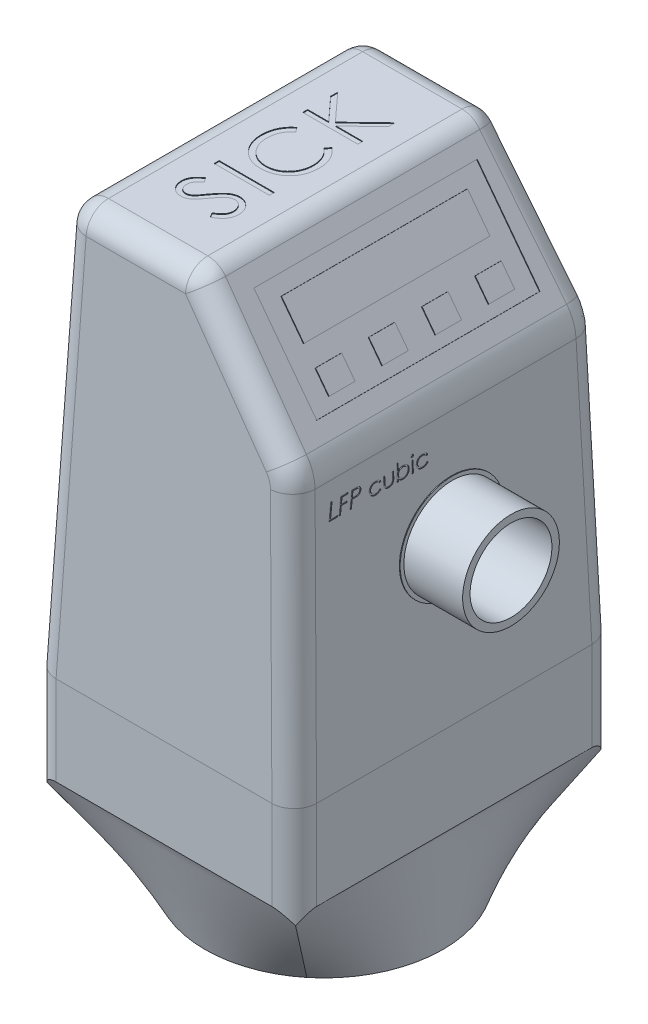
from build123d import *

# Parameters (mm, degrees)
BOSS_EXTRUDE1_DEPTH = 43
FILLET2_R           = 6
CUT_EXTRUDE5_DEPTH  = 79.096094653
FILLET3_R           = 3
SKETCH10_W          = 35
SKETCH10_H          = 43
BOSS_EXTRUDE2_DEPTH = 12
FILLET4_R           = 3
SKETCH17_W          = 30
SKETCH17_H          = 14
CUT_EXTRUDE6_DEPTH  = 0.1
SKETCH18_W          = 25
SKETCH18_H          = 5
SKETCH18_W_2        = 3.5
SKETCH18_H_2        = 3
BOSS_EXTRUDE3_DEPTH = 0.1
SKETCH23_W          = 7.408333334
SKETCH23_H          = 0.664850427
CUT_EXTRUDE8_DEPTH  = 0.1
SKETCH24_W          = 0.189957265
SKETCH24_H          = 1.546794872
CUT_EXTRUDE9_DEPTH  = 0.1
SKETCH25_R          = 6.5
SKETCH25_R_2        = 5.5
BOSS_EXTRUDE4_DEPTH = 8
SKETCH26_R          = 7
BOSS_EXTRUDE5_DEPTH = 0.1


with BuildPart() as part:
    # Sketch1 → Boss-Extrude1 (new body)
    with BuildSketch(Plane.XY):
        Polygon((0, 0), (35, 0), (33.770964999, 37.397128059), (20.457888171, 55), (2.764030826, 55), align=None)
    extrude(amount=BOSS_EXTRUDE1_DEPTH)

    # Fillet2
    fillet2_edges = [part.edges().sort_by_distance(p)[0] for p in [
        (33.770964999, 37.397128059, 21.5),
    ]]
    fillet(fillet2_edges, radius=FILLET2_R)

    # Sketch9 → Cut-Extrude5 (cut, through all)
    with BuildSketch(Plane(origin=(0, 0, 0), x_dir=(0, 0, -1), z_dir=(1, 0, 0))):
        Polygon((0, 55), (-1.5, 55), (0, 0), align=None)
        Polygon((-43, 55), (-41.5, 55), (-43, 0), align=None)
    extrude(amount=CUT_EXTRUDE5_DEPTH, mode=Mode.SUBTRACT)

    # Fillet3
    fillet3_edges = [part.edges().sort_by_distance(p)[0] for p in [
        (33.492928787, 37.298649734, 41.982764098),
        (33.492928787, 37.298649734, 1.017235902),
        (20.457888171, 55, 21.5),
        (2.764030826, 55, 21.5),
        (11.610959499, 55, 1.5),
        (1.382015413, 27.5, 0.75),
        (34.416758242, 17.746904445, 0.484006485),
        (26.54006445, 46.957999526, 1.280672714),
        (11.610959499, 55, 41.5),
        (1.382015413, 27.5, 42.25),
        (34.416758242, 17.746904445, 42.515993515),
        (26.54006445, 46.957999526, 41.719327286),
    ]]
    fillet(fillet3_edges, radius=FILLET3_R)

    # Sketch10 → Boss-Extrude2 (add)
    with BuildSketch(Plane.XZ):
        with Locations((17.5, 21.5)):
            Rectangle(SKETCH10_W, SKETCH10_H)
    extrude(amount=BOSS_EXTRUDE2_DEPTH)

    # Sketch12 for Loft3 → Loft3 section 0
    with BuildSketch(Plane(origin=(0, -27, 0), x_dir=(-1, 0, 0), z_dir=(0, -1, 0))):
        with BuildLine():
            # circular arc as an exact rational Bezier (weights 1, cos(half-angle), 1)
            Bezier((-27.600342374, -9.091007941), (-42.845675475, -21.5), (-27.600342374, -33.908992059), weights=[1, 0.631271398, 1])
            Bezier((-27.600342374, -33.908992059), (-17.5, -42.130200969), (-7.399657626, -33.908992059), weights=[1, 0.775562004, 1])
            Bezier((-7.399657626, -33.908992059), (7.845675475, -21.5), (-7.399657626, -9.091007941), weights=[1, 0.631271398, 1])
            Bezier((-7.399657626, -9.091007941), (-17.5, -0.869799031), (-27.600342374, -9.091007941), weights=[1, 0.775562004, 1])
        make_face()
    # Sketch11 → Loft3 section 1
    with BuildSketch(Plane(origin=(0, -12, 0), x_dir=(-1, 0, 0), z_dir=(0, -1, 0))):
        with BuildLine():
            Line((-35, 0), (-35, -43))
            Line((-35, -43), (0, -43))
            Line((0, -43), (0, 0))
            Line((0, 0), (-35, 0))
        make_face()
    loft()

    # Fillet4
    # the kernel refuses this fillet: 3 mm, written as the material it takes off along each edge
    with BuildSketch(Plane(origin=(0, 7.5, 0), x_dir=(1, 0, 0), z_dir=(0, -1, 0)), Plane(origin=(0, 7.5, 43), x_dir=(0, 0, -1), z_dir=(0, -1, 0))) as fillet4_piece_1:
        with BuildLine():
            CenterArc((FILLET4_R, FILLET4_R), FILLET4_R, 180, 90)
            Line((0, FILLET4_R), (0, 0))
            Line((0, 0), (FILLET4_R, 0))
        make_face()
    extrude(amount=27, mode=Mode.SUBTRACT)
    with BuildSketch(Plane(origin=(35, 7.5, 43), x_dir=(0, 0, -1), z_dir=(0, -1, 0)), Plane(origin=(35, 7.5, 0), x_dir=(-1, 0, 0), z_dir=(0, -1, 0))) as fillet4_piece_2:
        with BuildLine():
            CenterArc((FILLET4_R, -FILLET4_R), FILLET4_R, 90, 90)
            Line((0, -FILLET4_R), (0, 0))
            Line((0, 0), (FILLET4_R, 0))
        make_face()
    extrude(amount=27, mode=Mode.SUBTRACT)

    # Sketch17 → Cut-Extrude6 (cut)
    with BuildSketch(Plane(origin=(39.475056316, 29.855040658, 0), x_dir=(0, 0, -1), z_dir=(0.7975811093710329, 0.6032117157138714, 0))):
        with Locations((-21.185003541, 20.700547897)):
            Rectangle(SKETCH17_W, SKETCH17_H)
    extrude(amount=-CUT_EXTRUDE6_DEPTH, mode=Mode.SUBTRACT)

    # Sketch18 → Boss-Extrude3 (add)
    with BuildSketch(Plane(origin=(39.395298205, 29.794719487, 0), x_dir=(0, 0, -1), z_dir=(0.7975811093710329, 0.6032117157138717, 0))):
        with Locations((-21.185003541, 23.200547897)):
            Rectangle(SKETCH18_W, SKETCH18_H)
        with Locations((-31.935003541, 16.600547897)):
            Rectangle(SKETCH18_W_2, SKETCH18_H_2)
        with Locations((-24.785003541, 16.600547897)):
            Rectangle(SKETCH18_W_2, SKETCH18_H_2)
        with Locations((-17.635003541, 16.600547897)):
            Rectangle(SKETCH18_W_2, SKETCH18_H_2)
        with Locations((-10.485003541, 16.600547897)):
            Rectangle(SKETCH18_W_2, SKETCH18_H_2)
    extrude(amount=BOSS_EXTRUDE3_DEPTH)

    # Sketch23 → Cut-Extrude8 (cut)
    with BuildSketch(Plane(origin=(0, 55, 0), x_dir=(1, 0, 0), z_dir=(0, 1, 0))):
        with BuildLine():
            Line((14.634451947, -33.919087495), (14.25898954, -33.292822138))
            add(Edge.make_bspline(
                [(14.25898954, -33.292822138), (14.356492489, -33.234575202), (14.543304375, -33.122976321), (14.795733893, -32.936812611), (15.010283792, -32.743914616), (15.185705945, -32.54285386), (15.323816088, -32.334857603), (15.421610812, -32.118568023), (15.482604627, -31.89471399), (15.490013143, -31.742369401), (15.493711763, -31.666313056)],
                knots=[0, 0, 0, 0, 1.272034388, 2.437168799, 3.508375237, 4.49857839, 5.41946034, 6.295179144, 7.148887113, 8, 8, 8, 8], degree=3))
            add(Edge.make_bspline(
                [(15.493711763, -31.666313056), (15.491859668, -31.601372351), (15.488187885, -31.472627251), (15.454332222, -31.282722248), (15.398944428, -31.099209343), (15.323860277, -30.923912769), (15.23156553, -30.761476738), (15.122732704, -30.616751975), (14.996980268, -30.494547256), (14.858966757, -30.393238067), (14.710969987, -30.314845752), (14.558480338, -30.255596078), (14.399405537, -30.22241307), (14.292275767, -30.217433671), (14.238212965, -30.214920829)],
                knots=[0, 0, 0, 0, 1.09553864, 2.171907928, 3.244545276, 4.325730702, 5.384330216, 6.391480148, 7.371786628, 8.333890167, 9.27165687, 10.191402356, 11.087295184, 12, 12, 12, 12], degree=3))
            add(Edge.make_bspline(
                [(14.238212965, -30.214920829), (14.176510912, -30.217974429), (14.051557527, -30.224158302), (13.866888061, -30.278657186), (13.683347107, -30.361874701), (13.569793819, -30.440089812), (13.51103281, -30.480564192)],
                knots=[0, 0, 0, 0, 0.938992559, 1.901562324, 2.914110574, 4, 4, 4, 4], degree=3))
            add(Edge.make_bspline(
                [(13.51103281, -30.480564192), (13.468595002, -30.513728796), (13.379502132, -30.583353734), (13.246997249, -30.703152516), (13.110041623, -30.84301255), (12.965628598, -31.001019628), (12.814957649, -31.177438795), (12.656853016, -31.372338309), (12.494545583, -31.587381525), (12.385831002, -31.738319633), (12.329736068, -31.816201211)],
                knots=[0, 0, 0, 0, 0.72225051, 1.516274602, 2.393638633, 3.3469932, 4.386926276, 5.505032946, 6.712638081, 8, 8, 8, 8], degree=3))
            add(Edge.make_bspline(
                [(12.329736068, -31.816201211), (12.274218891, -31.894145336), (12.168074276, -32.043168568), (12.010542875, -32.251572567), (11.866516684, -32.437933347), (11.734639859, -32.601422599), (11.614894512, -32.741968412), (11.508430541, -32.860678299), (11.41236867, -32.954528245), (11.350051164, -33.006715891), (11.322072139, -33.030146857)],
                knots=[0, 0, 0, 0, 1.452282411, 2.77665338, 3.964542531, 5.026858415, 5.96415736, 6.766646006, 7.446254459, 8, 8, 8, 8], degree=3))
            add(Edge.make_bspline(
                [(11.322072139, -33.030146857), (11.278464447, -33.062891589), (11.192704067, -33.127288498), (11.058697297, -33.212384764), (10.921780532, -33.284146678), (10.781457555, -33.341901601), (10.638782976, -33.38860582), (10.492685652, -33.421077233), (10.344157378, -33.441091925), (10.244225594, -33.443159386), (10.194200879, -33.444194333)],
                knots=[0, 0, 0, 0, 1.068019517, 2.100403715, 3.106014851, 4.09224787, 5.069873182, 6.043214339, 7.020455327, 8, 8, 8, 8], degree=3))
            add(Edge.make_bspline(
                [(10.194200879, -33.444194333), (10.115821036, -33.441431764), (9.960736664, -33.435965673), (9.734190297, -33.389734794), (9.517887428, -33.316773819), (9.314019344, -33.214524662), (9.127708282, -33.082840017), (8.957277266, -32.929785489), (8.812045246, -32.749176977), (8.687130449, -32.549229928), (8.588347253, -32.331522086), (8.516758726, -32.102323068), (8.474236041, -31.863280432), (8.468303277, -31.701109953), (8.465292959, -31.61882374)],
                knots=[0, 0, 0, 0, 1.005248779, 1.989011071, 2.95484373, 3.928844559, 4.904706341, 5.875556129, 6.859318422, 7.868909462, 8.894684146, 9.918924798, 10.944050749, 12, 12, 12, 12], degree=3))
            add(Edge.make_bspline(
                [(8.465292959, -31.61882374), (8.468263141, -31.531509592), (8.474169885, -31.35786962), (8.526805631, -31.10286268), (8.610577802, -30.856339566), (8.708864506, -30.658906974), (8.806404599, -30.50405926), (8.895441356, -30.386086639), (8.997732004, -30.265889215), (9.11543299, -30.14475875), (9.246190174, -30.021499436), (9.391110427, -29.896679034), (9.548887781, -29.769129438), (9.661551125, -29.687100811), (9.719307716, -29.645049034)],
                knots=[0, 0, 0, 0, 1.286507425, 2.558452658, 3.822738219, 5.118007103, 5.800084425, 6.519418873, 7.295692132, 8.12638276, 9.008892966, 9.945018126, 10.946518512, 12, 12, 12, 12], degree=3))
            Line((9.719307716, -29.645049034), (10.174908344, -30.246085693))
            add(Edge.make_bspline(
                [(10.174908344, -30.246085693), (10.128151243, -30.28237527), (10.038108, -30.352260512), (9.912051375, -30.458403123), (9.796747858, -30.558293492), (9.696861173, -30.657462783), (9.604911411, -30.748267052), (9.52758464, -30.837963291), (9.462437702, -30.923090111), (9.392786955, -31.030134734), (9.325832937, -31.16573575), (9.267021704, -31.334537194), (9.232131741, -31.511537787), (9.227477957, -31.63202845), (9.225122019, -31.693025797)],
                knots=[0, 0, 0, 0, 1.181392137, 2.275085037, 3.289537922, 4.225335853, 5.084247276, 5.86831218, 6.587234301, 7.222706459, 8.415108401, 9.595592188, 10.782789524, 12, 12, 12, 12], degree=3))
            add(Edge.make_bspline(
                [(9.225122019, -31.693025797), (9.227644787, -31.769575163), (9.232509708, -31.917193404), (9.287040066, -32.126279835), (9.369949801, -32.315555232), (9.489504774, -32.477794039), (9.63203733, -32.611752106), (9.794585672, -32.70985473), (9.97411399, -32.768508564), (10.099287274, -32.775687692), (10.163036015, -32.779343906)],
                knots=[0, 0, 0, 0, 1.144248881, 2.206576175, 3.214949548, 4.222996039, 5.203671638, 6.127710127, 7.046472867, 8, 8, 8, 8], degree=3))
            add(Edge.make_bspline(
                [(10.163036015, -32.779343906), (10.202717543, -32.778464251), (10.282633378, -32.776692688), (10.400140359, -32.754054976), (10.517027763, -32.723446929), (10.632884208, -32.676523325), (10.750333185, -32.611178321), (10.871033566, -32.525459672), (10.996024995, -32.417476129), (11.077320806, -32.334763925), (11.120242545, -32.291094373)],
                knots=[0, 0, 0, 0, 0.858259122, 1.72847414, 2.583651051, 3.473048463, 4.427392529, 5.488649985, 6.674082839, 8, 8, 8, 8], degree=3))
            add(Edge.make_bspline(
                [(11.120242545, -32.291094373), (11.13471425, -32.274877802), (11.169095708, -32.236350939), (11.225382702, -32.165916897), (11.294815236, -32.07290464), (11.380725056, -31.959742981), (11.480380818, -31.824345399), (11.592508297, -31.666697005), (11.720747518, -31.488555094), (11.810404313, -31.362143705), (11.857810988, -31.295302773)],
                knots=[0, 0, 0, 0, 0.420754252, 0.999615792, 1.744751191, 2.668019286, 3.750313428, 4.999500688, 6.413464383, 8, 8, 8, 8], degree=3))
            add(Edge.make_bspline(
                [(11.857810988, -31.295302773), (11.916318574, -31.214899314), (12.029610405, -31.059209158), (12.199823035, -30.837683179), (12.36629606, -30.636827246), (12.527955564, -30.455921307), (12.683611445, -30.29322791), (12.835015703, -30.150387101), (12.981175452, -30.026750777), (13.167287082, -29.891829677), (13.39797926, -29.755599361), (13.680748094, -29.638793063), (13.964328385, -29.564482895), (14.154682129, -29.554832055), (14.248601253, -29.550070401)],
                knots=[0, 0, 0, 0, 1.163604038, 2.253157948, 3.268574773, 4.215621239, 5.091738613, 5.902582348, 6.650434646, 7.330118262, 8.591011492, 9.77460283, 10.902005569, 12, 12, 12, 12], degree=3))
            add(Edge.make_bspline(
                [(14.248601253, -29.550070401), (14.315018088, -29.551462762), (14.44656199, -29.554220443), (14.639728801, -29.585867095), (14.827292758, -29.63234039), (15.00674992, -29.70182183), (15.180979725, -29.788009384), (15.346700023, -29.895805198), (15.507130401, -30.021407724), (15.657773164, -30.165414871), (15.796233272, -30.322911108), (15.918890944, -30.489972942), (16.023518921, -30.664856398), (16.106844846, -30.849455347), (16.172454071, -31.041786705), (16.219858129, -31.242484712), (16.248984291, -31.451752669), (16.252005023, -31.593994492), (16.253540823, -31.666313056)],
                knots=[0, 0, 0, 0, 0.983922938, 1.948738757, 2.895227473, 3.844781104, 4.796118043, 5.772795661, 6.770647148, 7.813532943, 8.8582745, 9.876489951, 10.882905461, 11.874265028, 12.874055871, 13.891769171, 14.928133632, 16, 16, 16, 16], degree=3))
            add(Edge.make_bspline(
                [(16.253540823, -31.666313056), (16.252458821, -31.722267866), (16.250308446, -31.833472791), (16.231298071, -31.997957863), (16.204401361, -32.159119985), (16.161699605, -32.314936912), (16.109889908, -32.467415988), (16.046097466, -32.615894725), (15.96964802, -32.760442517), (15.882245477, -32.901879232), (15.780502786, -33.039807246), (15.662107138, -33.173082423), (15.530077586, -33.305210863), (15.382374501, -33.435255291), (15.217373659, -33.560378546), (15.037532815, -33.683584439), (14.842317162, -33.804272529), (14.705034514, -33.880101006), (14.634451947, -33.919087495)],
                knots=[0, 0, 0, 0, 0.915313873, 1.819100311, 2.706792138, 3.586475221, 4.459428225, 5.3405999, 6.2277379, 7.133009489, 8.059106158, 9.028520402, 10.047404263, 11.114294124, 12.246039232, 13.433834781, 14.680630578, 16, 16, 16, 16], degree=3))
        make_face()
        with Locations((12.359416891, -27.071128094)):
            Rectangle(SKETCH23_W, SKETCH23_H)
        with BuildLine():
            Line((10.014631902, -17.658745615), (10.459844241, -18.240489739))
            add(Edge.make_bspline(
                [(10.459844241, -18.240489739), (10.410386926, -18.281989295), (10.312139088, -18.364428903), (10.174166105, -18.497051296), (10.044947262, -18.635296495), (9.923652311, -18.77897215), (9.815156346, -18.931403248), (9.711009611, -19.086781735), (9.61982556, -19.2507532), (9.508432836, -19.476343011), (9.394729012, -19.772603653), (9.296933908, -20.144258235), (9.235266565, -20.532763551), (9.228542268, -20.797755007), (9.225122019, -20.932540353)],
                knots=[0, 0, 0, 0, 0.75789156, 1.505565099, 2.245254514, 2.979266606, 3.711207489, 4.440978832, 5.174393176, 5.91211879, 7.394186119, 8.890401545, 10.418332761, 12, 12, 12, 12], degree=3))
            add(Edge.make_bspline(
                [(9.225122019, -20.932540353), (9.225977073, -21.006800004), (9.227679245, -21.154630105), (9.250135227, -21.374019373), (9.281697288, -21.589311999), (9.328529223, -21.800367935), (9.387737931, -22.006918533), (9.458488398, -22.210314108), (9.546022783, -22.407609912), (9.64277203, -22.601535053), (9.752049765, -22.787334863), (9.87124765, -22.963132976), (9.999024201, -23.128298508), (10.135886314, -23.282924446), (10.281114736, -23.427307553), (10.436336506, -23.559630979), (10.599892254, -23.681662666), (10.771917804, -23.79270713), (10.950811005, -23.892672936), (11.137593228, -23.976728634), (11.329066386, -24.050142312), (11.526587886, -24.10914786), (11.728844899, -24.155488963), (11.936675318, -24.187527069), (12.149685108, -24.209722802), (12.294061237, -24.211417173), (12.366837097, -24.212271256)],
                knots=[0, 0, 0, 0, 1.054877232, 2.099964208, 3.13098259, 4.145888998, 5.169474743, 6.183358035, 7.203388855, 8.234598956, 9.261847606, 10.264062591, 11.251197969, 12.227332808, 13.196685059, 14.158975844, 15.123498106, 16.094582253, 17.066912473, 18.032714859, 19.002806091, 19.979168736, 20.95977404, 21.949109834, 22.966205168, 24, 24, 24, 24], degree=3))
            add(Edge.make_bspline(
                [(12.366837097, -24.212271256), (12.476332616, -24.209594143), (12.691312545, -24.204337987), (13.006244988, -24.157757916), (13.308240104, -24.086406372), (13.595253113, -23.981220652), (13.869676615, -23.84893292), (14.128182664, -23.683874306), (14.374558449, -23.491983985), (14.602836891, -23.271293408), (14.811354662, -23.029128027), (14.994977507, -22.769313312), (15.148043802, -22.49248612), (15.275416278, -22.201705707), (15.373326336, -21.894733733), (15.442253735, -21.57212241), (15.487216349, -21.234573351), (15.491520989, -21.003921455), (15.493711763, -20.886535078)],
                knots=[0, 0, 0, 0, 1.029159485, 2.020618137, 2.987588728, 3.942669054, 4.889339625, 5.846988364, 6.821327795, 7.821533711, 8.827683044, 9.822769455, 10.807800696, 11.797391277, 12.803701919, 13.832062008, 14.896664671, 16, 16, 16, 16], degree=3))
            add(Edge.make_bspline(
                [(15.493711763, -20.886535078), (15.490137179, -20.757201053), (15.483101543, -20.502640753), (15.423497799, -20.12932843), (15.326855206, -19.771959393), (15.191604604, -19.430514418), (15.015783078, -19.105956084), (14.802639237, -18.797776486), (14.5501456, -18.505715495), (14.357352978, -18.330092948), (14.25898954, -18.240489739)],
                knots=[0, 0, 0, 0, 1.028121516, 2.023589091, 2.998037872, 3.967518031, 4.937445131, 5.927275754, 6.942489185, 8, 8, 8, 8], degree=3))
            Line((14.25898954, -18.240489739), (14.699749757, -17.658745615))
            add(Edge.make_bspline(
                [(14.699749757, -17.658745615), (14.760154056, -17.705563923), (14.880673322, -17.79897628), (15.050612779, -17.950204736), (15.210313829, -18.109632634), (15.35897893, -18.277669768), (15.49722343, -18.454612314), (15.625122425, -18.640444035), (15.741997156, -18.835006307), (15.849352333, -19.036753743), (15.943874928, -19.246151231), (16.027635755, -19.461355353), (16.096980467, -19.683685616), (16.155638312, -19.911270491), (16.197463996, -20.146165393), (16.230770693, -20.385639842), (16.250530694, -20.631935236), (16.252528445, -20.797952367), (16.253540823, -20.882082955)],
                knots=[0, 0, 0, 0, 0.986911346, 1.969095443, 2.935967484, 3.900112155, 4.865124501, 5.834589912, 6.812044781, 7.795288262, 8.784678562, 9.777857908, 10.776141921, 11.791195789, 12.811324908, 13.855933174, 14.913475973, 16, 16, 16, 16], degree=3))
            add(Edge.make_bspline(
                [(16.253540823, -20.882082955), (16.252986272, -20.96176205), (16.251889716, -21.119317594), (16.234126295, -21.351936618), (16.209891018, -21.578397898), (16.173399408, -21.798054189), (16.130337221, -22.01210417), (16.072613061, -22.218607407), (16.007950659, -22.419595936), (15.93195177, -22.614262257), (15.846192517, -22.802771955), (15.749267051, -22.984517022), (15.641990437, -23.159413871), (15.526727332, -23.329182011), (15.399775376, -23.491313563), (15.262897666, -23.647213525), (15.116555544, -23.7977561), (15.011029437, -23.890895117), (14.957972914, -23.937723647)],
                knots=[0, 0, 0, 0, 1.114604814, 2.203992996, 3.262667896, 4.300477797, 5.318619304, 6.316056647, 7.298880507, 8.271930387, 9.238335007, 10.195173496, 11.151986948, 12.108099108, 13.064862484, 14.031167946, 15.010108607, 16, 16, 16, 16], degree=3))
            add(Edge.make_bspline(
                [(14.957972914, -23.937723647), (14.865808829, -24.0127242), (14.682593346, -24.161819834), (14.385682679, -24.352657894), (14.075958829, -24.515469594), (13.751627821, -24.64857833), (13.412563572, -24.750821369), (13.059311537, -24.822704872), (12.692577887, -24.869091186), (12.4431602, -24.874415369), (12.316379698, -24.877121684)],
                knots=[0, 0, 0, 0, 0.994611881, 1.977215934, 2.950189954, 3.921972279, 4.908960509, 5.911694611, 6.938501887, 8, 8, 8, 8], degree=3))
            add(Edge.make_bspline(
                [(12.316379698, -24.877121684), (12.183123988, -24.873829857), (11.920951698, -24.867353394), (11.53619683, -24.812328961), (11.167576369, -24.723812509), (10.815778443, -24.598089094), (10.478952683, -24.438692767), (10.159672133, -24.241786435), (9.855894907, -24.00965765), (9.57223035, -23.744126966), (9.312855387, -23.452942773), (9.084665589, -23.14111795), (8.894763514, -22.809262829), (8.736021636, -22.461033376), (8.614007523, -22.093822017), (8.528593278, -21.708412219), (8.475428715, -21.305528182), (8.468707858, -21.030652715), (8.465292959, -20.890987202)],
                knots=[0, 0, 0, 0, 1.032925535, 2.032216505, 3.007276963, 3.968222605, 4.92396291, 5.891752235, 6.871517503, 7.883894988, 8.900124299, 9.891468569, 10.874487609, 11.85992873, 12.854644235, 13.869047385, 14.917252991, 16, 16, 16, 16], degree=3))
            add(Edge.make_bspline(
                [(8.465292959, -20.890987202), (8.466314373, -20.805866849), (8.468336157, -20.637379682), (8.488021294, -20.388132521), (8.520905724, -20.145487807), (8.565429083, -19.909190352), (8.62149727, -19.678557003), (8.691376192, -19.454019237), (8.774571959, -19.23612689), (8.869577669, -19.024950748), (8.976411045, -18.821916367), (9.093811958, -18.627151209), (9.221187211, -18.441431749), (9.359840838, -18.265723278), (9.508622723, -18.09981082), (9.665790094, -17.941233216), (9.835375986, -17.79460651), (9.95477055, -17.70411548), (10.014631902, -17.658745615)],
                knots=[0, 0, 0, 0, 1.096622143, 2.170653093, 3.219033441, 4.250379162, 5.267604342, 6.275621678, 7.278284436, 8.271072515, 9.257558938, 10.232633088, 11.19973724, 12.157384997, 13.114417402, 14.069920322, 15.032307892, 16, 16, 16, 16], degree=3))
        make_face()
        Polygon((8.655250224, -15.512228521), (8.655250224, -14.847378094), (11.476412417, -14.847378094), (8.655250224, -11.759088497), (8.655250224, -10.810786213), (11.979502361, -14.451139111), (16.063583558, -10.525850316), (16.063583558, -11.411822872), (12.488528469, -14.847378094), (16.063583558, -14.847378094), (16.063583558, -15.512228521), align=None)
    extrude(amount=-CUT_EXTRUDE8_DEPTH, mode=Mode.SUBTRACT)

    # Sketch24 → Cut-Extrude9 (cut)
    # profile 1 of 9: a face of its own
    with BuildSketch(Plane(origin=(34.962238327, 1.149013757, 0), x_dir=(0, 0, -1), z_dir=(0.9994604019440667, 0.03284668850591543, 0))):
        Polygon((-37.021152137, 31.897984299), (-36.829498825, 31.897984299), (-37.100018323, 29.971274897), (-36.151080022, 29.971274897), (-36.175248691, 29.781317632), (-37.317960363, 29.781317632), align=None)
    # profile 2 of 9: a face of its own
    with BuildSketch(Plane(origin=(34.962238327, 1.149013757, 0), x_dir=(0, 0, -1), z_dir=(0.9994604019440667, 0.03284668850591543, 0))):
        Polygon((-34.685695406, 31.897984299), (-34.711560123, 31.708027034), (-35.49979797, 31.708027034), (-35.59901672, 31.002471478), (-34.821379167, 31.002471478), (-34.847243884, 30.812514213), (-35.625305449, 30.812514213), (-35.769893456, 29.781317632), (-35.961122757, 29.781317632), (-35.66431453, 31.897984299), align=None)
    # profile 3 of 9: a face of its own
    with BuildSketch(Plane(origin=(34.962238327, 1.149013757, 0), x_dir=(0, 0, -1), z_dir=(0.9994604019440667, 0.03284668850591543, 0))):
        with BuildLine():
            Line((-34.198929915, 31.897984299), (-33.639658414, 31.897984299))
            add(Edge.make_bspline(
                [(-33.639658414, 31.897984299), (-33.617324045, 31.89784494), (-33.574335824, 31.897576708), (-33.512414034, 31.894893846), (-33.455276407, 31.891194958), (-33.403005677, 31.886038257), (-33.355665035, 31.878198497), (-33.31333701, 31.869421412), (-33.27558343, 31.859573902), (-33.232520984, 31.843167959), (-33.183994838, 31.818013345), (-33.131810482, 31.780249435), (-33.086454921, 31.733829748), (-33.046848511, 31.680935356), (-33.015067777, 31.621215963), (-32.992501524, 31.555691094), (-32.978658574, 31.485152498), (-32.976954776, 31.436300253), (-32.976080022, 31.411218807)],
                knots=[0, 0, 0, 0, 1.135332684, 2.185238988, 3.150208107, 4.046040219, 4.854001743, 5.588181339, 6.243560949, 6.834748932, 7.927376448, 9.012417828, 10.094600696, 11.214043572, 12.361542901, 13.518161337, 14.725788303, 16, 16, 16, 16], degree=3))
            add(Edge.make_bspline(
                [(-32.976080022, 31.411218807), (-32.976359801, 31.394525072), (-32.976909116, 31.361748758), (-32.982624939, 31.313384947), (-32.991949274, 31.266763014), (-33.004714913, 31.221682283), (-33.020789399, 31.177977253), (-33.041177159, 31.136209808), (-33.065233376, 31.096093845), (-33.092071042, 31.057634077), (-33.122197135, 31.02192635), (-33.154019828, 30.988571858), (-33.188062231, 30.958373399), (-33.224147284, 30.931253798), (-33.261999855, 30.907037621), (-33.301539826, 30.885587423), (-33.343398793, 30.867791217), (-33.372319968, 30.858113854), (-33.386947409, 30.853219342)],
                knots=[0, 0, 0, 0, 1.077613652, 2.115775993, 3.139637116, 4.14510796, 5.138576732, 6.142762576, 7.14141659, 8.156821813, 9.16766358, 10.155287502, 11.131543445, 12.102666116, 13.067290607, 14.031007908, 15.004144336, 16, 16, 16, 16], degree=3))
            add(Edge.make_bspline(
                [(-33.386947409, 30.853219342), (-33.398788911, 30.849987259), (-33.42427021, 30.843032256), (-33.465867633, 30.83460182), (-33.513640885, 30.828220177), (-33.567464006, 30.822002543), (-33.627760138, 30.818261602), (-33.694173414, 30.814550548), (-33.766716336, 30.813220319), (-33.817036982, 30.812755656), (-33.843184055, 30.812514213)],
                knots=[0, 0, 0, 0, 0.641206386, 1.379788876, 2.215232503, 3.158725674, 4.209900022, 5.370746801, 6.633815758, 8, 8, 8, 8], degree=3))
            Line((-33.843184055, 30.812514213), (-34.159920834, 30.812514213))
            Line((-34.159920834, 30.812514213), (-34.304508841, 29.781317632))
            Line((-34.304508841, 29.781317632), (-34.495738141, 29.781317632))
            Line((-34.495738141, 29.781317632), (-34.198929915, 31.897984299))
        make_face()
        with BuildLine():
            Line((-34.034413355, 31.708027034), (-34.133208093, 31.002471478))
            Line((-34.133208093, 31.002471478), (-33.836399867, 31.002471478))
            add(Edge.make_bspline(
                [(-33.836399867, 31.002471478), (-33.812372786, 31.002711448), (-33.766291604, 31.003171681), (-33.69996521, 31.004512315), (-33.6394849, 31.00819491), (-33.584706043, 31.012016704), (-33.535765961, 31.017989473), (-33.492654315, 31.02521456), (-33.454957427, 31.032869355), (-33.413108281, 31.045784291), (-33.366615481, 31.066162989), (-33.316935593, 31.098381594), (-33.272733777, 31.137737283), (-33.235177421, 31.184174828), (-33.204330397, 31.235321963), (-33.181974922, 31.290363277), (-33.168315205, 31.348222048), (-33.166801713, 31.387824505), (-33.166037287, 31.407826713)],
                knots=[0, 0, 0, 0, 1.292499712, 2.478866002, 3.567711026, 4.55136461, 5.4320969, 6.218239379, 6.902667729, 7.499057556, 8.571240445, 9.621392161, 10.671323708, 11.74113212, 12.821985709, 13.872330035, 14.925367204, 16, 16, 16, 16], degree=3))
            add(Edge.make_bspline(
                [(-33.166037287, 31.407826713), (-33.166565631, 31.424122165), (-33.167585021, 31.455562694), (-33.176623796, 31.500955148), (-33.19203656, 31.542330818), (-33.21278942, 31.579894933), (-33.238847393, 31.612868884), (-33.2698137, 31.640803131), (-33.305437628, 31.663536666), (-33.33918766, 31.677783421), (-33.36990525, 31.686576575), (-33.397506008, 31.692539609), (-33.429582193, 31.696823437), (-33.465864516, 31.701350039), (-33.506648932, 31.703857289), (-33.551710382, 31.70673797), (-33.601210589, 31.707753202), (-33.635701255, 31.707933305), (-33.653650801, 31.708027034)],
                knots=[0, 0, 0, 0, 1.185493767, 2.287297747, 3.351910597, 4.388303413, 5.399095946, 6.397186861, 7.410490164, 8.461641879, 9.051030142, 9.735191633, 10.515167525, 11.40603511, 12.396458938, 13.488902119, 14.693180664, 16, 16, 16, 16], degree=3))
            Line((-33.653650801, 31.708027034), (-34.034413355, 31.708027034))
        make_face(mode=Mode.SUBTRACT)
    # profile 4 of 9: a face of its own
    with BuildSketch(Plane(origin=(34.962238327, 1.149013757, 0), x_dir=(0, 0, -1), z_dir=(0.9994604019440667, 0.03284668850591543, 0))):
        with BuildLine():
            Line((-30.316678312, 30.992719208), (-30.475682719, 30.89392447))
            add(Edge.make_bspline(
                [(-30.475682719, 30.89392447), (-30.493117924, 30.915592117), (-30.527436163, 30.958241203), (-30.587028939, 31.013280544), (-30.650535842, 31.060552993), (-30.71904209, 31.099078595), (-30.792451598, 31.128845853), (-30.870474865, 31.149909834), (-30.953100765, 31.163035733), (-31.00974591, 31.164527582), (-31.038770326, 31.165291991)],
                knots=[0, 0, 0, 0, 1.026593902, 2.0206758, 2.988051866, 3.946915611, 4.916868779, 5.907761954, 6.927957743, 8, 8, 8, 8], degree=3))
            add(Edge.make_bspline(
                [(-31.038770326, 31.165291991), (-31.061968362, 31.164652853), (-31.107656263, 31.163394089), (-31.174728079, 31.155525838), (-31.23861655, 31.141228052), (-31.299722122, 31.12238914), (-31.357610184, 31.097140155), (-31.412432406, 31.06641235), (-31.46467506, 31.030701135), (-31.512824232, 30.989329044), (-31.556868441, 30.944335564), (-31.59502826, 30.896103567), (-31.628252025, 30.846077728), (-31.654320865, 30.793008817), (-31.675653944, 30.738110918), (-31.689688485, 30.680347777), (-31.699040943, 30.62045941), (-31.700110966, 30.579626891), (-31.700652671, 30.558955186)],
                knots=[0, 0, 0, 0, 1.112346261, 2.190735716, 3.231507886, 4.247384806, 5.251966152, 6.253067467, 7.256802811, 8.280671706, 9.291813951, 10.270744147, 11.225547591, 12.165006084, 13.100104208, 14.043489273, 15.009504848, 16, 16, 16, 16], degree=3))
            add(Edge.make_bspline(
                [(-31.700652671, 30.558955186), (-31.699576647, 30.531880472), (-31.697439098, 30.478095854), (-31.68068631, 30.398703859), (-31.65326374, 30.321945246), (-31.615733516, 30.248364992), (-31.568273535, 30.180272336), (-31.51253108, 30.11920139), (-31.448475253, 30.066335506), (-31.376670463, 30.022506884), (-31.298802685, 29.987272628), (-31.215714383, 29.962170574), (-31.128084516, 29.947019854), (-31.068088055, 29.94511126), (-31.037498291, 29.944138145)],
                knots=[0, 0, 0, 0, 0.966302908, 1.919585723, 2.883856336, 3.870342332, 4.860282998, 5.839159637, 6.814385684, 7.815993281, 8.834850808, 9.858348828, 10.908058873, 12, 12, 12, 12], degree=3))
            add(Edge.make_bspline(
                [(-31.037498291, 29.944138145), (-31.009464441, 29.944924031), (-30.954370487, 29.946468507), (-30.873835987, 29.959488404), (-30.797164326, 29.980802411), (-30.724358231, 30.010525037), (-30.655550741, 30.048944059), (-30.59118643, 30.0963327), (-30.529984563, 30.151327692), (-30.494003058, 30.193853322), (-30.475682719, 30.215505666)],
                knots=[0, 0, 0, 0, 1.039848629, 2.043578496, 3.018386758, 3.987534228, 4.954977003, 5.934852016, 6.948509513, 8, 8, 8, 8], degree=3))
            Line((-30.475682719, 30.215505666), (-30.316678312, 30.111198775))
            add(Edge.make_bspline(
                [(-30.316678312, 30.111198775), (-30.326105161, 30.097355336), (-30.344927569, 30.069714405), (-30.376391895, 30.030741058), (-30.410331031, 29.994260802), (-30.44661257, 29.960322538), (-30.484762772, 29.928114117), (-30.526084888, 29.899175307), (-30.569246511, 29.871879486), (-30.614754335, 29.847318368), (-30.662137852, 29.825240736), (-30.711330388, 29.806256551), (-30.76211818, 29.789946059), (-30.814560941, 29.776981568), (-30.86876206, 29.766633585), (-30.924581363, 29.759767299), (-30.981999624, 29.754641771), (-31.020808497, 29.754335842), (-31.040466373, 29.75418088)],
                knots=[0, 0, 0, 0, 0.954134338, 1.905101784, 2.851144739, 3.791306361, 4.734911809, 5.6936923, 6.663572882, 7.643865596, 8.638447847, 9.640600242, 10.646758161, 11.676244097, 12.717260333, 13.78922464, 14.880174919, 16, 16, 16, 16], degree=3))
            add(Edge.make_bspline(
                [(-31.040466373, 29.75418088), (-31.070469146, 29.754719892), (-31.129274797, 29.75577636), (-31.215346028, 29.767392914), (-31.297601913, 29.784905377), (-31.376014348, 29.81004154), (-31.450595542, 29.84239919), (-31.521275952, 29.881924562), (-31.587821544, 29.928945882), (-31.649574255, 29.982626224), (-31.706289701, 30.040828897), (-31.754988874, 30.103633371), (-31.797228632, 30.168730577), (-31.831148242, 30.237558242), (-31.858149002, 30.309201587), (-31.876597163, 30.384234541), (-31.888528957, 30.462038524), (-31.889909858, 30.515096028), (-31.890609936, 30.541994716)],
                knots=[0, 0, 0, 0, 1.1129367, 2.181364009, 3.217532258, 4.231199276, 5.232079859, 6.230262199, 7.231623845, 8.250719726, 9.263571943, 10.242672461, 11.195837495, 12.138959767, 13.085126421, 14.0317438, 15.002148558, 16, 16, 16, 16], degree=3))
            add(Edge.make_bspline(
                [(-31.890609936, 30.541994716), (-31.890343226, 30.560245483), (-31.889812697, 30.596549272), (-31.883727626, 30.650430574), (-31.875866645, 30.703594314), (-31.862546318, 30.755366601), (-31.847160793, 30.806532657), (-31.827520829, 30.856475771), (-31.804482185, 30.905428026), (-31.778325055, 30.953263319), (-31.748879957, 30.999194707), (-31.71629464, 31.04258859), (-31.681796398, 31.083966258), (-31.643771321, 31.121899199), (-31.603833054, 31.157904419), (-31.560851673, 31.191020047), (-31.515073705, 31.221343408), (-31.467186648, 31.249435213), (-31.41721837, 31.274447823), (-31.365470908, 31.295997448), (-31.312256076, 31.314414006), (-31.257488751, 31.328994162), (-31.201532446, 31.341220889), (-31.143946208, 31.348912158), (-31.08495034, 31.354346714), (-31.045002174, 31.354945907), (-31.024777938, 31.355249256)],
                knots=[0, 0, 0, 0, 0.990994727, 1.971252077, 2.943264845, 3.907940874, 4.872158414, 5.844625996, 6.82015047, 7.809835459, 8.804511986, 9.781214284, 10.756496977, 11.728388426, 12.696359165, 13.676225489, 14.672885716, 15.677705647, 16.690706858, 17.706033469, 18.721040654, 19.747369689, 20.783475414, 21.830280724, 22.901553713, 24, 24, 24, 24], degree=3))
            add(Edge.make_bspline(
                [(-31.024777938, 31.355249256), (-30.999450444, 31.354691732), (-30.948922055, 31.353579469), (-30.873967437, 31.34421857), (-30.80011682, 31.330105594), (-30.728665953, 31.309197264), (-30.660481156, 31.28387972), (-30.596657336, 31.255448221), (-30.538696892, 31.222431485), (-30.485521636, 31.186315035), (-30.437032118, 31.145577725), (-30.392730592, 31.099732565), (-30.351708595, 31.049018151), (-30.32845144, 31.0116404), (-30.316678312, 30.992719208)],
                knots=[0, 0, 0, 0, 1.095225653, 2.184976855, 3.262915854, 4.344593502, 5.400796181, 6.407717688, 7.363229445, 8.282371371, 9.184954523, 10.097238608, 11.036792983, 12, 12, 12, 12], degree=3))
        make_face()
    # profile 5 of 9: a face of its own
    with BuildSketch(Plane(origin=(34.962238327, 1.149013757, 0), x_dir=(0, 0, -1), z_dir=(0.9994604019440667, 0.03284668850591543, 0))):
        with BuildLine():
            Line((-29.963900534, 31.328112504), (-29.773943269, 31.328112504))
            Line((-29.773943269, 31.328112504), (-29.773943269, 30.610684619))
            add(Edge.make_bspline(
                [(-29.773943269, 30.610684619), (-29.773857451, 30.589625147), (-29.773693284, 30.549339364), (-29.772579953, 30.491369798), (-29.769961277, 30.438503501), (-29.766687202, 30.390709931), (-29.762476768, 30.347997175), (-29.757467307, 30.310514421), (-29.751868166, 30.277836605), (-29.746387382, 30.258155623), (-29.743838435, 30.249002595)],
                knots=[0, 0, 0, 0, 1.388932606, 2.656963016, 3.823490214, 4.879454478, 5.816252168, 6.653371382, 7.373723809, 8, 8, 8, 8], degree=3))
            add(Edge.make_bspline(
                [(-29.743838435, 30.249002595), (-29.739749365, 30.237498287), (-29.731656235, 30.214728843), (-29.716976556, 30.181836445), (-29.698816562, 30.151371393), (-29.67894419, 30.12215893), (-29.656024072, 30.095064395), (-29.630346202, 30.070133543), (-29.602770125, 30.046424402), (-29.561794468, 30.018372647), (-29.505757674, 29.988306709), (-29.432186722, 29.962364953), (-29.352416071, 29.946861385), (-29.297283122, 29.945062669), (-29.268945273, 29.944138145)],
                knots=[0, 0, 0, 0, 0.725840625, 1.436591201, 2.137033971, 2.831655856, 3.53531722, 4.242432219, 4.957935707, 5.694543706, 7.190802206, 8.724350549, 10.316345118, 12, 12, 12, 12], degree=3))
            add(Edge.make_bspline(
                [(-29.268945273, 29.944138145), (-29.240610056, 29.945082329), (-29.185786655, 29.946909149), (-29.106892459, 29.961897289), (-29.034773747, 29.986937873), (-28.970154362, 30.021897593), (-28.913327401, 30.064679698), (-28.865971872, 30.114880263), (-28.826899865, 30.170911083), (-28.809839882, 30.212714813), (-28.80126031, 30.233738172)],
                knots=[0, 0, 0, 0, 1.157059328, 2.238695713, 3.266970494, 4.264342957, 5.228770407, 6.160125903, 7.074715775, 8, 8, 8, 8], degree=3))
            add(Edge.make_bspline(
                [(-28.80126031, 30.233738172), (-28.798723799, 30.242184457), (-28.793116194, 30.260857131), (-28.787091343, 30.292534408), (-28.781663931, 30.330310621), (-28.777029534, 30.374432966), (-28.773724412, 30.424786139), (-28.771942767, 30.481354404), (-28.769929953, 30.543960179), (-28.769899403, 30.58778592), (-28.76988344, 30.610684619)],
                knots=[0, 0, 0, 0, 0.557542046, 1.232589297, 2.036731608, 2.971723315, 4.038036528, 5.22795436, 6.551621927, 8, 8, 8, 8], degree=3))
            Line((-28.76988344, 30.610684619), (-28.76988344, 31.328112504))
            Line((-28.76988344, 31.328112504), (-28.579926175, 31.328112504))
            Line((-28.579926175, 31.328112504), (-28.579926175, 30.575067632))
            add(Edge.make_bspline(
                [(-28.579926175, 30.575067632), (-28.580193296, 30.549481867), (-28.580711545, 30.499841981), (-28.584042177, 30.427703495), (-28.589756943, 30.360476804), (-28.598430852, 30.298126323), (-28.60863057, 30.240699656), (-28.621787935, 30.1881232), (-28.637498583, 30.140558946), (-28.655221442, 30.097172253), (-28.676159429, 30.057834369), (-28.698431008, 30.020498899), (-28.72414837, 29.986092219), (-28.751223702, 29.952901593), (-28.781341846, 29.922577908), (-28.813938428, 29.894425349), (-28.848554648, 29.868013563), (-28.885958687, 29.844372646), (-28.925604497, 29.823074961), (-28.96754102, 29.804196666), (-29.012281909, 29.789257488), (-29.059249918, 29.776369609), (-29.108675161, 29.766261335), (-29.160509989, 29.759133269), (-29.214736943, 29.754763664), (-29.251693616, 29.754378403), (-29.27064132, 29.75418088)],
                knots=[0, 0, 0, 0, 1.493040784, 2.896703357, 4.213163133, 5.428574705, 6.569057535, 7.615249723, 8.588095153, 9.490268104, 10.346124644, 11.18633936, 12.024365274, 12.850166724, 13.684164916, 14.514361689, 15.362232829, 16.222528818, 17.093394965, 17.986930858, 18.902426812, 19.842810585, 20.827885679, 21.843828298, 22.894529745, 24, 24, 24, 24], degree=3))
            add(Edge.make_bspline(
                [(-29.27064132, 29.75418088), (-29.289447307, 29.754386322), (-29.326402822, 29.754790035), (-29.380632575, 29.759109128), (-29.432611017, 29.76625026), (-29.482153354, 29.776443653), (-29.529309299, 29.789167281), (-29.574269863, 29.804288467), (-29.616508589, 29.823084758), (-29.656532944, 29.844237852), (-29.694029626, 29.868165424), (-29.729171481, 29.894392762), (-29.761911387, 29.922880714), (-29.792256566, 29.953510306), (-29.81978108, 29.986661501), (-29.844827925, 30.022067626), (-29.867782694, 30.05937786), (-29.888557953, 30.099330344), (-29.906405538, 30.143219131), (-29.922162758, 30.191779757), (-29.935050621, 30.245544612), (-29.945538685, 30.304467731), (-29.953975985, 30.368267113), (-29.959833794, 30.437311821), (-29.963109083, 30.511433673), (-29.963631029, 30.562626702), (-29.963900534, 30.58906002)],
                knots=[0, 0, 0, 0, 1.083640291, 2.129454052, 3.13281866, 4.105697902, 5.042300162, 5.946461698, 6.836384745, 7.703652036, 8.553297018, 9.397182691, 10.228592656, 11.052265423, 11.879314572, 12.708807002, 13.549817954, 14.402308542, 15.300838682, 16.27712199, 17.341985831, 18.484375296, 19.725102775, 21.0496083, 22.476576903, 24, 24, 24, 24], degree=3))
            Line((-29.963900534, 30.58906002), (-29.963900534, 31.328112504))
        make_face()
    # profile 6 of 9: a face of its own
    with BuildSketch(Plane(origin=(34.962238327, 1.149013757, 0), x_dir=(0, 0, -1), z_dir=(0.9994604019440667, 0.03284668850591543, 0))):
        with BuildLine():
            Line((-28.145738141, 29.781317632), (-28.145738141, 31.952257803))
            Line((-28.145738141, 31.952257803), (-27.955780876, 31.952257803))
            Line((-27.955780876, 31.952257803), (-27.955780876, 31.047416724))
            add(Edge.make_bspline(
                [(-27.955780876, 31.047416724), (-27.934376285, 31.072065569), (-27.892615044, 31.12015648), (-27.822597857, 31.182959583), (-27.749176394, 31.236210367), (-27.671792115, 31.280107686), (-27.59033496, 31.313535058), (-27.505225542, 31.337980979), (-27.416246294, 31.352729249), (-27.355577079, 31.354402065), (-27.324851389, 31.355249256)],
                knots=[0, 0, 0, 0, 1.077089805, 2.101446609, 3.097517232, 4.067117542, 5.031729543, 5.997785507, 6.985986182, 8, 8, 8, 8], degree=3))
            add(Edge.make_bspline(
                [(-27.324851389, 31.355249256), (-27.29753663, 31.354499213), (-27.243530695, 31.353016251), (-27.164136253, 31.341746818), (-27.087746797, 31.323472243), (-27.014403905, 31.298137448), (-26.944449806, 31.264522981), (-26.877285519, 31.224281333), (-26.813255152, 31.17636101), (-26.753350531, 31.121570603), (-26.698139466, 31.062088265), (-26.649811424, 30.998479217), (-26.608990179, 30.931668091), (-26.575225541, 30.861878529), (-26.549117332, 30.788825498), (-26.531130342, 30.712580625), (-26.519704295, 30.633218919), (-26.518264813, 30.579205938), (-26.517533013, 30.551746986)],
                knots=[0, 0, 0, 0, 1.034377878, 2.045141349, 3.03070803, 4.00595497, 4.978199603, 5.965204761, 6.967410914, 8.002051993, 9.036360596, 10.037508045, 11.022711142, 11.997267194, 12.969246472, 13.954813154, 14.960274251, 16, 16, 16, 16], degree=3))
            add(Edge.make_bspline(
                [(-26.517533013, 30.551746986), (-26.518280765, 30.524714118), (-26.519755215, 30.47140956), (-26.531016672, 30.392967976), (-26.549610842, 30.317470286), (-26.576196891, 30.245111578), (-26.60961902, 30.175551916), (-26.651414887, 30.109584244), (-26.699681539, 30.046060673), (-26.7555199, 29.987021619), (-26.815943811, 29.932451896), (-26.880601472, 29.885035016), (-26.947864253, 29.844082281), (-27.018780517, 29.811633511), (-27.092300237, 29.785386287), (-27.169211066, 29.767172255), (-27.249077875, 29.756544741), (-27.303336441, 29.754975041), (-27.330787554, 29.75418088)],
                knots=[0, 0, 0, 0, 1.024244038, 2.01964794, 2.996620209, 3.965911562, 4.936179293, 5.91563013, 6.920572822, 7.955171681, 8.990768464, 10.002129126, 10.989675881, 11.969873457, 12.952483066, 13.943799762, 14.959703725, 16, 16, 16, 16], degree=3))
            add(Edge.make_bspline(
                [(-27.330787554, 29.75418088), (-27.362214074, 29.755052105), (-27.423836001, 29.756760425), (-27.513977374, 29.770923332), (-27.599298121, 29.795030115), (-27.680770162, 29.827422224), (-27.757228833, 29.871284791), (-27.829159566, 29.925687207), (-27.896108748, 29.991525904), (-27.935549394, 30.041758329), (-27.955780876, 30.067525565)],
                knots=[0, 0, 0, 0, 1.035807596, 2.031038093, 2.998900396, 3.954262848, 4.914341711, 5.895762244, 6.92060972, 8, 8, 8, 8], degree=3))
            Line((-27.955780876, 30.067525565), (-27.955780876, 29.781317632))
            Line((-27.955780876, 29.781317632), (-28.145738141, 29.781317632))
        make_face()
        with BuildLine():
            add(Edge.make_bspline(
                [(-27.332483601, 29.944138145), (-27.304716349, 29.945126102), (-27.249908212, 29.947076171), (-27.169448396, 29.962300219), (-27.092453612, 29.987630135), (-27.019311843, 30.02227314), (-26.951167688, 30.065829323), (-26.890296809, 30.118532007), (-26.83618289, 30.178706732), (-26.791036339, 30.246581394), (-26.753343801, 30.31882079), (-26.727451962, 30.394811725), (-26.710083369, 30.472520478), (-26.708358408, 30.525223086), (-26.707490278, 30.551746986)],
                knots=[0, 0, 0, 0, 1.031910345, 2.036826888, 3.032245421, 4.038315463, 5.03827337, 6.029480047, 7.023177075, 8.037597977, 9.052889626, 10.043399556, 11.015292101, 12, 12, 12, 12], degree=3))
            add(Edge.make_bspline(
                [(-26.707490278, 30.551746986), (-26.708631914, 30.578244956), (-26.710910627, 30.631135111), (-26.726861091, 30.709542291), (-26.754715088, 30.785492902), (-26.79167694, 30.858776733), (-26.837559007, 30.927119545), (-26.891386423, 30.988496908), (-26.953000658, 31.041449851), (-27.021231964, 31.085591465), (-27.093912365, 31.121610814), (-27.170409082, 31.146312329), (-27.249123756, 31.162482567), (-27.302581983, 31.164350754), (-27.329515518, 31.165291991)],
                knots=[0, 0, 0, 0, 0.984795267, 1.965658976, 2.959410029, 3.983795688, 5.009594896, 6.01088574, 7.009236619, 8.019050059, 9.024672985, 10.014834719, 10.999826153, 12, 12, 12, 12], degree=3))
            add(Edge.make_bspline(
                [(-27.329515518, 31.165291991), (-27.357012535, 31.164351286), (-27.411588533, 31.162484176), (-27.492123601, 31.14628392), (-27.57078092, 31.121459889), (-27.645945284, 31.085820454), (-27.716009404, 31.042210189), (-27.778670364, 30.990962545), (-27.832694687, 30.932433743), (-27.877171158, 30.866813568), (-27.912492156, 30.795944523), (-27.937761375, 30.720341905), (-27.952880209, 30.640403682), (-27.954802222, 30.585592172), (-27.955780876, 30.55768315)],
                knots=[0, 0, 0, 0, 1.016820015, 2.018181405, 3.029022337, 4.06341356, 5.088169224, 6.076823655, 7.05054209, 8.02560866, 9.001194327, 9.972267242, 10.967515442, 12, 12, 12, 12], degree=3))
            add(Edge.make_bspline(
                [(-27.955780876, 30.55768315), (-27.955200504, 30.536312184), (-27.954058148, 30.494247359), (-27.945331211, 30.432484422), (-27.931448501, 30.373379171), (-27.911888388, 30.316867198), (-27.886185261, 30.263269303), (-27.855215243, 30.212169293), (-27.818354009, 30.164028263), (-27.776681929, 30.118964236), (-27.730742775, 30.077955685), (-27.681440698, 30.042408854), (-27.629783188, 30.01179932), (-27.575179253, 29.987400296), (-27.518264329, 29.967487591), (-27.45845438, 29.954343849), (-27.396362614, 29.945287516), (-27.354000798, 29.944525303), (-27.332483601, 29.944138145)],
                knots=[0, 0, 0, 0, 1.050331198, 2.067384183, 3.060053655, 4.031335885, 5.001026174, 5.976994447, 6.963687968, 7.976578778, 8.990422448, 9.985569286, 10.960374351, 11.936812464, 12.921228065, 13.919088064, 14.943024695, 16, 16, 16, 16], degree=3))
        make_face(mode=Mode.SUBTRACT)
    # profile 7 of 9: a face of its own
    with BuildSketch(Plane(origin=(34.962238327, 1.149013757, 0), x_dir=(0, 0, -1), z_dir=(0.9994604019440667, 0.03284668850591543, 0))):
        with BuildLine():
            add(Edge.make_bspline(
                [(-26.070624626, 31.979394555), (-26.058837021, 31.978847758), (-26.035754626, 31.977777025), (-26.00237584, 31.968607941), (-25.971982314, 31.95306575), (-25.945023399, 31.932213753), (-25.921890115, 31.907690994), (-25.905694162, 31.879109361), (-25.895284761, 31.848231041), (-25.894027729, 31.826692392), (-25.893387714, 31.815726019)],
                knots=[0, 0, 0, 0, 1.055194115, 2.066272739, 3.074728998, 4.095836921, 5.109056067, 6.073838105, 7.019297344, 8, 8, 8, 8], degree=3))
            add(Edge.make_bspline(
                [(-25.893387714, 31.815726019), (-25.894042163, 31.805044319), (-25.895335931, 31.783927863), (-25.905686122, 31.753584858), (-25.922028142, 31.725400363), (-25.945008565, 31.700925219), (-25.971986245, 31.680084749), (-26.002374796, 31.664539502), (-26.035754901, 31.655371229), (-26.058837114, 31.654300384), (-26.070624626, 31.65375353)],
                knots=[0, 0, 0, 0, 0.96129708, 1.900370562, 2.859976407, 3.87933698, 4.906634145, 5.921202961, 6.938410037, 8, 8, 8, 8], degree=3))
            add(Edge.make_bspline(
                [(-26.070624626, 31.65375353), (-26.082277345, 31.654279503), (-26.10495784, 31.655303242), (-26.137836835, 31.664719396), (-26.167971207, 31.680090069), (-26.1949827, 31.700788762), (-26.217498102, 31.725550676), (-26.233886137, 31.753567658), (-26.244212423, 31.783932242), (-26.245509413, 31.80504579), (-26.246165492, 31.815726019)],
                knots=[0, 0, 0, 0, 1.054934014, 2.053291228, 3.073705704, 4.106921865, 5.123545215, 6.088680038, 7.033164197, 8, 8, 8, 8], degree=3))
            add(Edge.make_bspline(
                [(-26.246165492, 31.815726019), (-26.245523787, 31.826690866), (-26.244263438, 31.848226518), (-26.233878397, 31.879126847), (-26.217634608, 31.90753947), (-26.194967791, 31.932350129), (-26.167975175, 31.953060463), (-26.13783581, 31.968428057), (-26.104958111, 31.97784501), (-26.082277437, 31.978868638), (-26.070624626, 31.979394555)],
                knots=[0, 0, 0, 0, 0.98631895, 1.937192651, 2.907499808, 3.917963147, 4.944918757, 5.95915025, 6.951458133, 8, 8, 8, 8], degree=3))
        make_face()
    # profile 8 of 9: a face of its own
    with BuildSketch(Plane(origin=(34.962238327, 1.149013757, 0), x_dir=(0, 0, -1), z_dir=(0.9994604019440667, 0.03284668850591543, 0))):
        with Locations((-26.069776602, 30.554715068)):
            Rectangle(SKETCH24_W, SKETCH24_H)
    # profile 9 of 9: a face of its own
    with BuildSketch(Plane(origin=(34.962238327, 1.149013757, 0), x_dir=(0, 0, -1), z_dir=(0.9994604019440667, 0.03284668850591543, 0))):
        with BuildLine():
            Line((-23.993815064, 30.992719208), (-24.152819471, 30.89392447))
            add(Edge.make_bspline(
                [(-24.152819471, 30.89392447), (-24.170254676, 30.915592117), (-24.204572915, 30.958241203), (-24.264165691, 31.013280544), (-24.327672594, 31.060552993), (-24.396178842, 31.099078595), (-24.46958835, 31.128845853), (-24.547611617, 31.149909834), (-24.630237518, 31.163035733), (-24.686882662, 31.164527582), (-24.715907078, 31.165291991)],
                knots=[0, 0, 0, 0, 1.026593902, 2.0206758, 2.988051866, 3.946915611, 4.916868779, 5.907761954, 6.927957743, 8, 8, 8, 8], degree=3))
            add(Edge.make_bspline(
                [(-24.715907078, 31.165291991), (-24.739105114, 31.164652853), (-24.784793015, 31.163394089), (-24.851864831, 31.155525838), (-24.915753302, 31.141228052), (-24.976858874, 31.12238914), (-25.034746936, 31.097140155), (-25.089569159, 31.06641235), (-25.141811812, 31.030701135), (-25.189960984, 30.989329044), (-25.234005193, 30.944335564), (-25.272165013, 30.896103567), (-25.305388777, 30.846077728), (-25.331457617, 30.793008817), (-25.352790697, 30.738110918), (-25.366825237, 30.680347777), (-25.376177695, 30.62045941), (-25.377247718, 30.579626891), (-25.377789423, 30.558955186)],
                knots=[0, 0, 0, 0, 1.112346261, 2.190735716, 3.231507886, 4.247384806, 5.251966152, 6.253067467, 7.256802811, 8.280671706, 9.291813951, 10.270744147, 11.225547591, 12.165006084, 13.100104208, 14.043489273, 15.009504848, 16, 16, 16, 16], degree=3))
            add(Edge.make_bspline(
                [(-25.377789423, 30.558955186), (-25.376713399, 30.531880472), (-25.37457585, 30.478095854), (-25.357823062, 30.398703859), (-25.330400492, 30.321945246), (-25.292870268, 30.248364992), (-25.245410287, 30.180272336), (-25.189667832, 30.11920139), (-25.125612005, 30.066335506), (-25.053807215, 30.022506884), (-24.975939437, 29.987272628), (-24.892851135, 29.962170574), (-24.805221268, 29.947019854), (-24.745224807, 29.94511126), (-24.714635043, 29.944138145)],
                knots=[0, 0, 0, 0, 0.966302908, 1.919585723, 2.883856336, 3.870342332, 4.860282998, 5.839159637, 6.814385684, 7.815993281, 8.834850808, 9.858348828, 10.908058873, 12, 12, 12, 12], degree=3))
            add(Edge.make_bspline(
                [(-24.714635043, 29.944138145), (-24.686601193, 29.944924031), (-24.63150724, 29.946468507), (-24.550972739, 29.959488404), (-24.474301078, 29.980802411), (-24.401494984, 30.010525037), (-24.332687493, 30.048944059), (-24.268323182, 30.0963327), (-24.207121315, 30.151327692), (-24.17113981, 30.193853322), (-24.152819471, 30.215505666)],
                knots=[0, 0, 0, 0, 1.039848629, 2.043578496, 3.018386758, 3.987534228, 4.954977003, 5.934852016, 6.948509513, 8, 8, 8, 8], degree=3))
            Line((-24.152819471, 30.215505666), (-23.993815064, 30.111198775))
            add(Edge.make_bspline(
                [(-23.993815064, 30.111198775), (-24.003241913, 30.097355336), (-24.022064321, 30.069714405), (-24.053528647, 30.030741058), (-24.087467783, 29.994260802), (-24.123749323, 29.960322538), (-24.161899524, 29.928114117), (-24.203221641, 29.899175307), (-24.246383263, 29.871879486), (-24.291891087, 29.847318368), (-24.339274604, 29.825240736), (-24.388467141, 29.806256551), (-24.439254932, 29.789946059), (-24.491697693, 29.776981568), (-24.545898812, 29.766633585), (-24.601718115, 29.759767299), (-24.659136376, 29.754641771), (-24.697945249, 29.754335842), (-24.717603125, 29.75418088)],
                knots=[0, 0, 0, 0, 0.954134338, 1.905101784, 2.851144739, 3.791306361, 4.734911809, 5.6936923, 6.663572882, 7.643865596, 8.638447847, 9.640600242, 10.646758161, 11.676244097, 12.717260333, 13.78922464, 14.880174919, 16, 16, 16, 16], degree=3))
            add(Edge.make_bspline(
                [(-24.717603125, 29.75418088), (-24.747605898, 29.754719892), (-24.80641155, 29.75577636), (-24.89248278, 29.767392914), (-24.974738665, 29.784905377), (-25.0531511, 29.81004154), (-25.127732294, 29.84239919), (-25.198412704, 29.881924562), (-25.264958296, 29.928945882), (-25.326711007, 29.982626224), (-25.383426453, 30.040828897), (-25.432125626, 30.103633371), (-25.474365385, 30.168730577), (-25.508284994, 30.237558242), (-25.535285754, 30.309201587), (-25.553733915, 30.384234541), (-25.565665709, 30.462038524), (-25.56704661, 30.515096028), (-25.567746688, 30.541994716)],
                knots=[0, 0, 0, 0, 1.1129367, 2.181364009, 3.217532258, 4.231199276, 5.232079859, 6.230262199, 7.231623845, 8.250719726, 9.263571943, 10.242672461, 11.195837495, 12.138959767, 13.085126421, 14.0317438, 15.002148558, 16, 16, 16, 16], degree=3))
            add(Edge.make_bspline(
                [(-25.567746688, 30.541994716), (-25.567479978, 30.560245483), (-25.566949449, 30.596549272), (-25.560864378, 30.650430574), (-25.553003397, 30.703594314), (-25.53968307, 30.755366601), (-25.524297545, 30.806532657), (-25.504657581, 30.856475771), (-25.481618937, 30.905428026), (-25.455461807, 30.953263319), (-25.426016709, 30.999194707), (-25.393431392, 31.04258859), (-25.35893315, 31.083966258), (-25.320908073, 31.121899199), (-25.280969806, 31.157904419), (-25.237988425, 31.191020047), (-25.192210457, 31.221343408), (-25.1443234, 31.249435213), (-25.094355122, 31.274447823), (-25.04260766, 31.295997448), (-24.989392828, 31.314414006), (-24.934625503, 31.328994162), (-24.878669198, 31.341220889), (-24.82108296, 31.348912158), (-24.762087093, 31.354346714), (-24.722138926, 31.354945907), (-24.70191469, 31.355249256)],
                knots=[0, 0, 0, 0, 0.990994727, 1.971252077, 2.943264845, 3.907940874, 4.872158414, 5.844625996, 6.82015047, 7.809835459, 8.804511986, 9.781214284, 10.756496977, 11.728388426, 12.696359165, 13.676225489, 14.672885716, 15.677705647, 16.690706858, 17.706033469, 18.721040654, 19.747369689, 20.783475414, 21.830280724, 22.901553713, 24, 24, 24, 24], degree=3))
            add(Edge.make_bspline(
                [(-24.70191469, 31.355249256), (-24.676587196, 31.354691732), (-24.626058807, 31.353579469), (-24.551104189, 31.34421857), (-24.477253572, 31.330105594), (-24.405802705, 31.309197264), (-24.337617908, 31.28387972), (-24.273794088, 31.255448221), (-24.215833644, 31.222431485), (-24.162658388, 31.186315035), (-24.114168871, 31.145577725), (-24.069867344, 31.099732565), (-24.028845347, 31.049018151), (-24.005588193, 31.0116404), (-23.993815064, 30.992719208)],
                knots=[0, 0, 0, 0, 1.095225653, 2.184976855, 3.262915854, 4.344593502, 5.400796181, 6.407717688, 7.363229445, 8.282371371, 9.184954523, 10.097238608, 11.036792983, 12, 12, 12, 12], degree=3))
        make_face()
    extrude(amount=-CUT_EXTRUDE9_DEPTH, mode=Mode.SUBTRACT)


with BuildPart() as body_2:
    # Sketch25 → Boss-Extrude4 (new body)
    with BuildSketch(Plane(origin=(35, 0, 0), x_dir=(0, 0, -1), z_dir=(1, 0, 0))):
        with Locations((-21.869198028, 22.071755537)):
            Circle(SKETCH25_R)
        with Locations((-21.869198028, 22.071755537)):
            Circle(SKETCH25_R_2, mode=Mode.SUBTRACT)
    extrude(amount=BOSS_EXTRUDE4_DEPTH)

    # Sketch26 → Boss-Extrude5 (add)
    with BuildSketch(Plane(origin=(35, 0, 0), x_dir=(0, 0, -1), z_dir=(1, 0, 0))):
        with Locations((-21.869198028, 22.071755537)):
            Circle(SKETCH26_R)
    extrude(amount=BOSS_EXTRUDE5_DEPTH)


solid = Compound([part.part, body_2.part])
